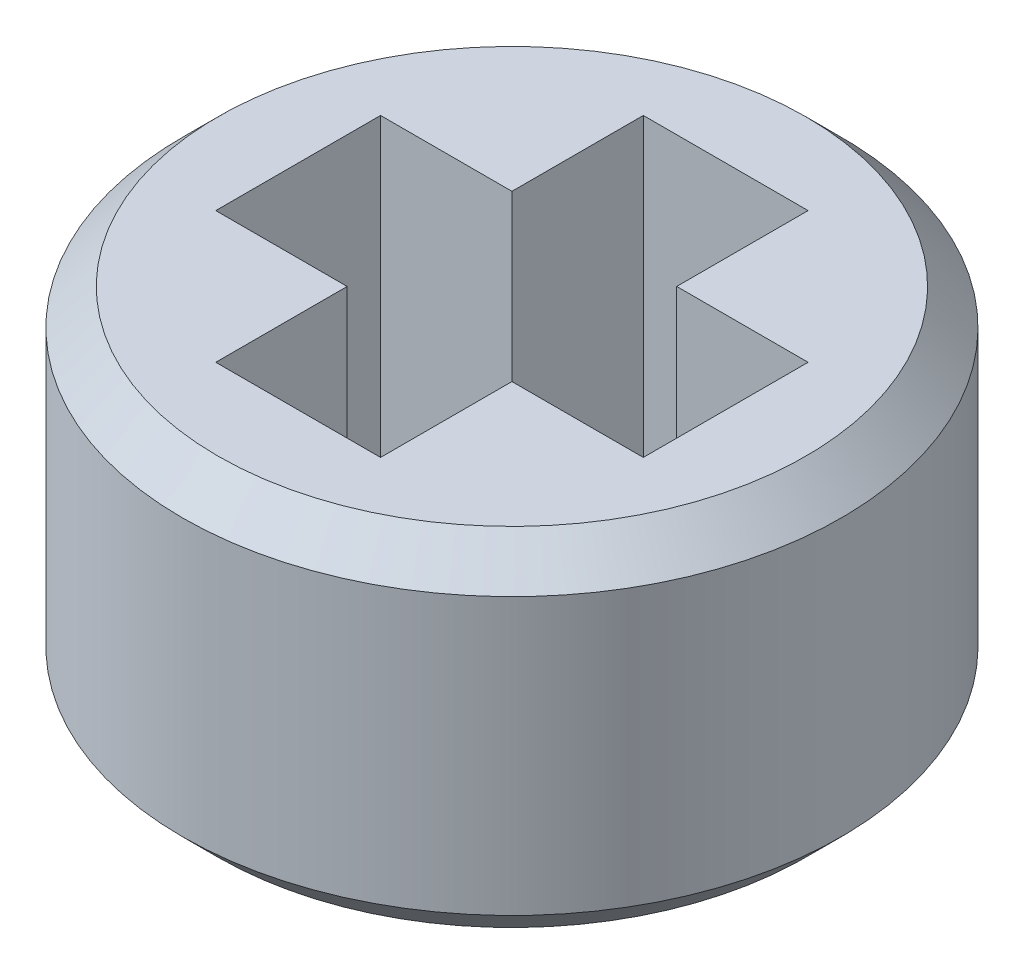
from build123d import *

# Parameters (mm, degrees)
SKETCH1_R           = 3.7
BOSS_EXTRUDE1_DEPTH = 1.95
CUT_EXTRUDE1_DEPTH  = 7.52610144
CHAMFER1_SIZE       = 0.4


with BuildPart() as part:
    # Sketch1 → Boss-Extrude1 (new, symmetric)
    with BuildSketch(Plane(origin=(0, 0, 0), x_dir=(1, 0, 0), z_dir=(0, 1, 0))):
        Circle(SKETCH1_R)
    extrude(amount=BOSS_EXTRUDE1_DEPTH, both=True)

    # Sketch2 → Cut-Extrude1 (cut, through all)
    with BuildSketch(Plane(origin=(0, 1.95, 0), x_dir=(1, 0, 0), z_dir=(0, 1, 0))):
        Polygon((0.925, 0.925), (2.4, 0.925), (2.4, -0.925), (0.925, -0.925), (0.925, -2.4), (-0.925, -2.4), (-0.925, -0.925), (-2.4, -0.925), (-2.4, 0.925), (-0.925, 0.925), (-0.925, 2.4), (0.925, 2.4), align=None)
    extrude(amount=-CUT_EXTRUDE1_DEPTH, mode=Mode.SUBTRACT)

    # Chamfer1
    chamfer1_edges = [part.edges().sort_by_distance(p)[0] for p in [
        (-3.7, -1.95, 0),
        (-3.7, 1.95, 0),
    ]]
    chamfer(chamfer1_edges, length=CHAMFER1_SIZE)


solid = part.part
